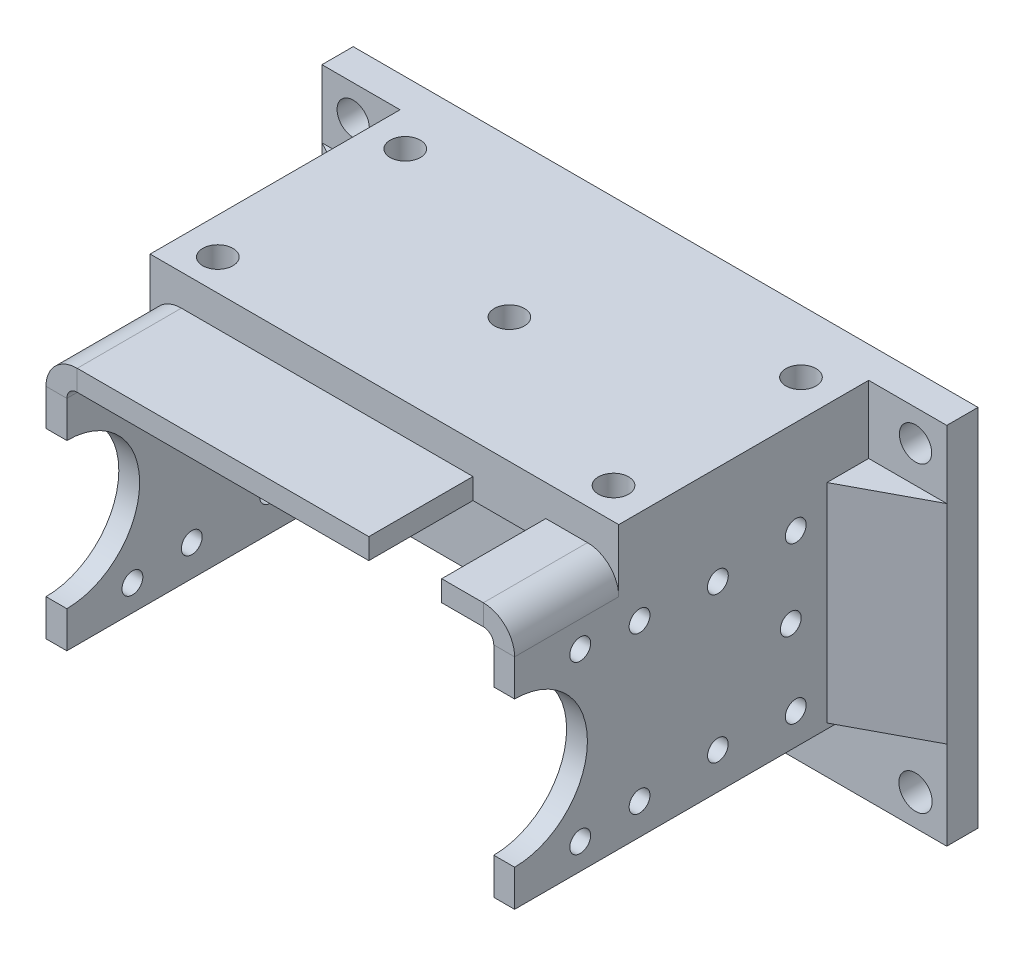
from build123d import *

# Parameters (mm, degrees)
SM_BASE_FLANGE_1_DEPTH = 30
SKETCH_6_R             = 1
CUT_EXTRUDE_1_DEPTH    = 56.577333509
SKETCH_7_W             = 7
SKETCH_7_H             = 10
CUT_EXTRUDE_2_DEPTH    = 2
EXTRUDE_START          = 4
EXTRUDE_1_DEPTH        = 4
SKETCH_9_W             = 60
SKETCH_9_H             = 40
SKETCH_9_R             = 1.6
EXTRUDE_2_DEPTH        = 3
SKETCH_13_R            = 1
SKETCH_13_R_2          = 0.99
CUT_EXTRUDE_6_DEPTH    = 64.945132928
EXTRUDE_3_DEPTH        = 24
SKETCH_15_R            = 1.45
CUT_EXTRUDE_9_DEPTH    = 8
EXTRUDE_4_DEPTH        = 10
SKETCH_20_R            = 1.55
SKETCH_20_W            = 60
SKETCH_20_H            = 5.002163953
CUT_EXTRUDE_10_DEPTH   = 10


# Sheet-metal steps are written as plain solids
with BuildPart() as part:
    # Sketch 1 → 基体-法兰1 (new body)
    with BuildSketch(Plane.XY):
        with BuildLine():
            Line((-20.5, -11.2), (-20.5, 9.8))
            ThreePointArc((-20.5, 9.8), (-20.207106781, 10.507106781), (-19.5, 10.8))
            Line((-19.5, 10.8), (19.5, 10.8))
            ThreePointArc((19.5, 10.8), (20.207106781, 10.507106781), (20.5, 9.8))
            Line((20.5, 9.8), (20.5, -11.2))
            Line((20.5, -11.2), (22.5, -11.2))
            Line((22.5, -11.2), (22.5, 9.8))
            ThreePointArc((22.5, 9.8), (21.621320344, 11.921320344), (19.5, 12.8))
            Line((19.5, 12.8), (-19.5, 12.8))
            ThreePointArc((-19.5, 12.8), (-21.621320344, 11.921320344), (-22.5, 9.8))
            Line((-22.5, 9.8), (-22.5, -11.2))
            Line((-22.5, -11.2), (-20.5, -11.2))
        make_face()
    extrude(amount=SM_BASE_FLANGE_1_DEPTH)

    # 草图6 → 切除-拉伸1 (cut, through all)
    with BuildSketch(Plane.ZY.offset(22.5)):
        with BuildLine():
            Line((30, -7.692697161), (30, 6.292697161))
            ThreePointArc((30, 6.292697161), (23.007302839, -0.7), (30, -7.692697161))
        make_face()
        with Locations((3, 6.8)):
            Circle(SKETCH_6_R)
        with Locations((18, 6.8)):
            Circle(SKETCH_6_R)
        with Locations((18, -8.2)):
            Circle(SKETCH_6_R)
        with Locations((3, -8.2)):
            Circle(SKETCH_6_R)
    extrude(amount=-CUT_EXTRUDE_1_DEPTH, mode=Mode.SUBTRACT)

    # 草图7 → 切除-拉伸2 (cut)
    with BuildSketch(Plane(origin=(0, 12.8, 0), x_dir=(1, 0, 0), z_dir=(0, 1, 0))):
        with Locations((12, -25)):
            Rectangle(SKETCH_7_W, SKETCH_7_H)
    extrude(amount=-CUT_EXTRUDE_2_DEPTH, mode=Mode.SUBTRACT)

    # 草图8 → 凸台-拉伸1 (add)
    with BuildSketch(Plane(origin=(0, 0, 0), x_dir=(-1, 0, 0), z_dir=(0, 0, -1)).offset(EXTRUDE_START)):
        with BuildLine():
            Line((22.5, -11.2), (22.5, 9.8))
            ThreePointArc((22.5, 9.8), (21.621320344, 11.921320344), (19.5, 12.8))
            Line((19.5, 12.8), (-19.5, 12.8))
            ThreePointArc((-19.5, 12.8), (-21.621320344, 11.921320344), (-22.5, 9.8))
            Line((-22.5, 9.8), (-22.5, -11.2))
            Line((-22.5, -11.2), (-20.5, -11.2))
            Line((-20.5, -11.2), (-20.5, 9.8))
            ThreePointArc((-20.5, 9.8), (-20.207106781, 10.507106781), (-19.5, 10.8))
            Line((-19.5, 10.8), (19.5, 10.8))
            ThreePointArc((19.5, 10.8), (20.207106781, 10.507106781), (20.5, 9.8))
            Line((20.5, 9.8), (20.5, -11.2))
            Line((20.5, -11.2), (22.5, -11.2))
        make_face()
    extrude(amount=-EXTRUDE_1_DEPTH)

    # 草图9 → 凸台-拉伸2 (add)
    with BuildSketch(Plane(origin=(0, 0, -4), x_dir=(-1, 0, 0), z_dir=(0, 0, -1))):
        with Locations((0, 0.802163953)):
            Rectangle(SKETCH_9_W, SKETCH_9_H)
        with Locations((-27, 17.802163953)):
            Circle(SKETCH_9_R, mode=Mode.SUBTRACT)
        with Locations((27, 17.802163953)):
            Circle(SKETCH_9_R, mode=Mode.SUBTRACT)
        with Locations((27, -16.197836047)):
            Circle(SKETCH_9_R, mode=Mode.SUBTRACT)
        with Locations((-27, -16.197836047)):
            Circle(SKETCH_9_R, mode=Mode.SUBTRACT)
        with Locations((0, 7.802163953)):
            Circle(SKETCH_9_R, mode=Mode.SUBTRACT)
        with Locations((7, 0.802163953)):
            Circle(SKETCH_9_R, mode=Mode.SUBTRACT)
        with Locations((0, -6.197836047)):
            Circle(SKETCH_9_R, mode=Mode.SUBTRACT)
        with Locations((-7, 0.802163953)):
            Circle(SKETCH_9_R, mode=Mode.SUBTRACT)
        with Locations((0, 0.802163953)):
            Circle(SKETCH_9_R, mode=Mode.SUBTRACT)
    extrude(amount=EXTRUDE_2_DEPTH)

    # 草图13 → 切除-拉伸6 (cut, through all)
    with BuildSketch(Plane(origin=(22.5, 0, 0), x_dir=(0, 0, -1), z_dir=(1, 0, 0))):
        with Locations(Location((-23.7, 7.3, 0), (0, 0, 90))):
            Circle(SKETCH_13_R)
        with Locations(Location((-10.48, 6.3, 0), (0, 0, 90))):
            Circle(SKETCH_13_R)
        with Locations(Location((-3.48, -0.7, 0), (0, 0, 90))):
            Circle(SKETCH_13_R)
        with Locations(Location((-23.7, -8.7, 0), (0, 0, 90))):
            Circle(SKETCH_13_R)
        with Locations(Location((-10.48, -7.7, 0), (0, 0, 90))):
            Circle(SKETCH_13_R_2)
    extrude(amount=-CUT_EXTRUDE_6_DEPTH, mode=Mode.SUBTRACT)

    # 草图14 → 凸台-拉伸3 (add)
    with BuildSketch(Plane.XY.offset(-4)):
        with BuildLine():
            Line((-19.5, 12.8), (19.5, 12.8))
            ThreePointArc((19.5, 12.8), (21.621320344, 11.921320344), (22.5, 9.8))
            Line((22.5, 9.8), (22.5, 15.8))
            Line((22.5, 15.8), (-22.5, 15.8))
            Line((-22.5, 15.8), (-22.5, 9.8))
            ThreePointArc((-22.5, 9.8), (-21.621320344, 11.921320344), (-19.5, 12.8))
        make_face()
    extrude(amount=EXTRUDE_3_DEPTH)

    # 草图15 → 切除-拉伸9 (cut)
    with BuildSketch(Plane(origin=(0, 15.8, 0), x_dir=(1, 0, 0), z_dir=(0, 1, 0))):
        with Locations(Location((-19, 1, 0), (0, 0, 270))):
            Circle(SKETCH_15_R)
        with Locations(Location((0, -8, 0), (0, 0, 270))):
            Circle(SKETCH_15_R)
        with Locations(Location((19, -17, 0), (0, 0, 270))):
            Circle(SKETCH_15_R)
        with Locations(Location((19, 1, 0), (0, 0, 270))):
            Circle(SKETCH_15_R)
        with Locations(Location((-19, -17, 0), (0, 0, 270))):
            Circle(SKETCH_15_R)
    extrude(amount=-CUT_EXTRUDE_9_DEPTH, mode=Mode.SUBTRACT)

    # 草图18 → 凸台-拉伸4 (add, symmetric)
    with BuildSketch(Plane(origin=(0, -0.7, 0), x_dir=(-1, 0, 0), z_dir=(0, -1, 0))):
        Polygon((22.5, 4), (22.5, 0), (30, 4), align=None)
        Polygon((-22.5, 4), (-22.5, 0), (-30, 4), align=None)
    extrude(amount=EXTRUDE_4_DEPTH, both=True)

    # 草图20 → 切除-拉伸10 (cut)
    with BuildSketch(Plane.XY.offset(-4)):
        with Locations((-27, 12.802163953)):
            Circle(SKETCH_20_R)
        with Locations((0, 18.301081977)):
            Rectangle(SKETCH_20_W, SKETCH_20_H)
        with Locations((27, 12.802163953)):
            Circle(SKETCH_20_R)
    extrude(amount=-CUT_EXTRUDE_10_DEPTH, mode=Mode.SUBTRACT)


solid = part.part
